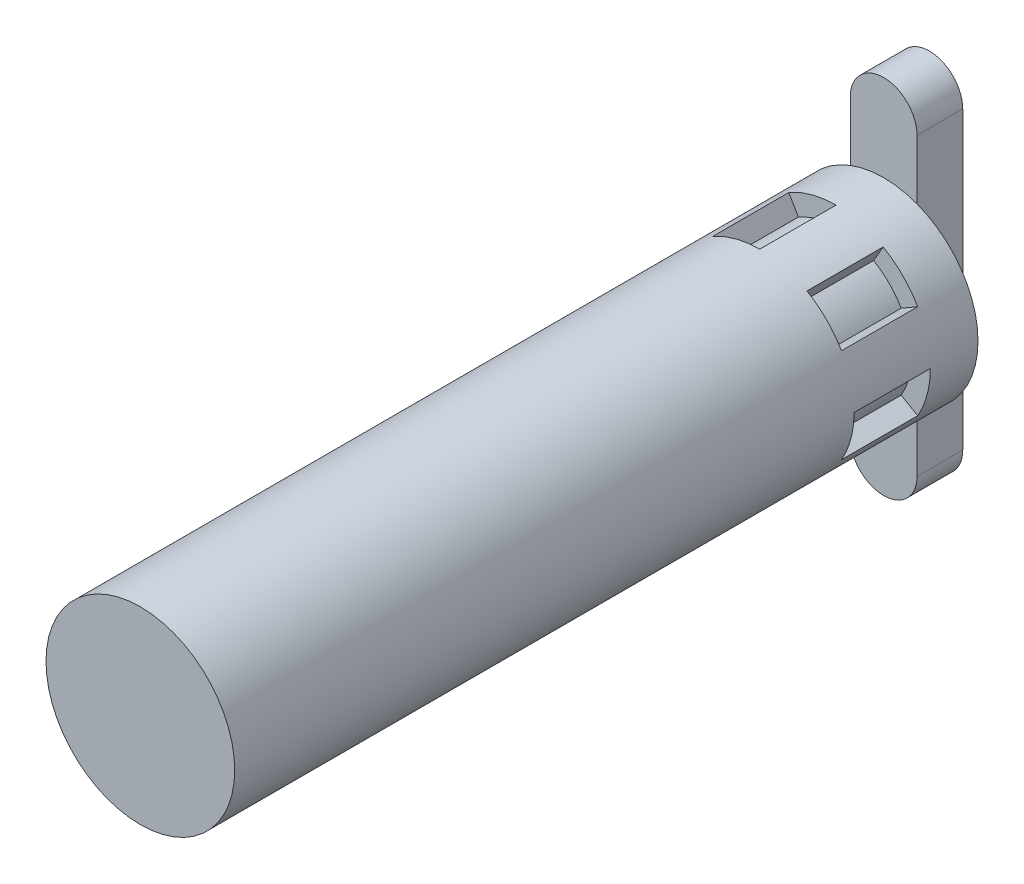
from build123d import *

# Parameters (mm, degrees)
SKETCH_1_R               = 4.95
EXTRUDE_1_DEPTH          = 4.5
CUT_EXTRUDE_1_DEPTH      = 2
PATTERN_CIRCULAR_1_COUNT = 6
MIRROR_1_COPY_1_DEPTH    = 2
MIRROR_1_COPY_2_DEPTH    = 2
MIRROR_1_COPY_3_DEPTH    = 2
MIRROR_1_COPY_4_DEPTH    = 2
MIRROR_1_COPY_5_DEPTH    = 2
EXTRUDE_2_DEPTH          = 2.4
SKETCH_5_R               = 4.95
EXTRUDE_3_DEPTH          = 30


with BuildPart() as part:
    # 草图1 → 凸台-拉伸1 (new body)
    with BuildSketch(Plane.XY):
        Circle(SKETCH_1_R)
    extrude_1 = extrude(amount=EXTRUDE_1_DEPTH)

    # 草图2 → 切除-拉伸1 (cut)
    with BuildSketch(Plane(origin=(0, 0, 0), x_dir=(-1, 0, 0), z_dir=(0, 0, -1))):
        with BuildLine():
            Line((0, 4.95), (0, 3.95))
            ThreePointArc((0, 3.95), (1.022335228, 3.815407014), (1.975, 3.420800345))
            Line((1.975, 3.420800345), (2.475, 4.286825749))
            ThreePointArc((2.475, 4.286825749), (1.281154273, 4.78133284), (0, 4.95))
        make_face()
    cut_extrude_1 = extrude(amount=-CUT_EXTRUDE_1_DEPTH, mode=Mode.SUBTRACT)

    # 阵列(圆周)1: 切除-拉伸1 ×6 about axis
    pattern_circular_1_axis = Axis((0, 0, 4.5), (0, 0, 1))
    for i in range(1, PATTERN_CIRCULAR_1_COUNT):
        add(cut_extrude_1.rotate(pattern_circular_1_axis, i * 360 / PATTERN_CIRCULAR_1_COUNT), mode=Mode.SUBTRACT)

    # 镜向1: 凸台-拉伸1, 切除-拉伸1 across plane
    add(extrude_1.mirror(Plane.XY))
    add(cut_extrude_1.mirror(Plane.XY), mode=Mode.SUBTRACT)

    # 镜向1 copy 1 sketch → 镜向1 copy 1 (cut)
    with BuildSketch(Plane(origin=(0, 0, 0), x_dir=(-0.5000000000000001, -0.8660254037844386, 0), z_dir=(0, 0, 1))):
        with BuildLine():
            Line((0, -4.95), (0, -3.95))
            ThreePointArc((0, -3.95), (1.022335228, -3.815407014), (1.975, -3.420800345))
            Line((1.975, -3.420800345), (2.475, -4.286825749))
            ThreePointArc((2.475, -4.286825749), (1.281154273, -4.78133284), (0, -4.95))
        make_face()
    extrude(amount=-MIRROR_1_COPY_1_DEPTH, mode=Mode.SUBTRACT)

    # 镜向1 copy 2 sketch → 镜向1 copy 2 (cut)
    with BuildSketch(Plane(origin=(0, 0, 0), x_dir=(0.4999999999999998, -0.8660254037844387, 0), z_dir=(0, 0, 1))):
        with BuildLine():
            Line((0, -4.95), (0, -3.95))
            ThreePointArc((0, -3.95), (1.022335228, -3.815407014), (1.975, -3.420800345))
            Line((1.975, -3.420800345), (2.475, -4.286825749))
            ThreePointArc((2.475, -4.286825749), (1.281154273, -4.78133284), (0, -4.95))
        make_face()
    extrude(amount=-MIRROR_1_COPY_2_DEPTH, mode=Mode.SUBTRACT)

    # 镜向1 copy 3 sketch → 镜向1 copy 3 (cut)
    with BuildSketch(Plane.XY):
        with BuildLine():
            Line((0, -4.95), (0, -3.95))
            ThreePointArc((0, -3.95), (1.022335228, -3.815407014), (1.975, -3.420800345))
            Line((1.975, -3.420800345), (2.475, -4.286825749))
            ThreePointArc((2.475, -4.286825749), (1.281154273, -4.78133284), (0, -4.95))
        make_face()
    extrude(amount=-MIRROR_1_COPY_3_DEPTH, mode=Mode.SUBTRACT)

    # 镜向1 copy 4 sketch → 镜向1 copy 4 (cut)
    with BuildSketch(Plane(origin=(0, 0, 0), x_dir=(0.5000000000000004, 0.8660254037844384, 0), z_dir=(0, 0, 1))):
        with BuildLine():
            Line((0, -4.95), (0, -3.95))
            ThreePointArc((0, -3.95), (1.022335228, -3.815407014), (1.975, -3.420800345))
            Line((1.975, -3.420800345), (2.475, -4.286825749))
            ThreePointArc((2.475, -4.286825749), (1.281154273, -4.78133284), (0, -4.95))
        make_face()
    extrude(amount=-MIRROR_1_COPY_4_DEPTH, mode=Mode.SUBTRACT)

    # 镜向1 copy 5 sketch → 镜向1 copy 5 (cut)
    with BuildSketch(Plane(origin=(0, 0, 0), x_dir=(-0.5000000000000001, 0.8660254037844386, 0), z_dir=(0, 0, 1))):
        with BuildLine():
            Line((0, -4.95), (0, -3.95))
            ThreePointArc((0, -3.95), (1.022335228, -3.815407014), (1.975, -3.420800345))
            Line((1.975, -3.420800345), (2.475, -4.286825749))
            ThreePointArc((2.475, -4.286825749), (1.281154273, -4.78133284), (0, -4.95))
        make_face()
    extrude(amount=-MIRROR_1_COPY_5_DEPTH, mode=Mode.SUBTRACT)

    # 草图3 → 凸台-拉伸2 (add)
    with BuildSketch(Plane(origin=(0, 0, -4.5), x_dir=(-1, 0, 0), z_dir=(0, 0, -1))):
        with BuildLine():
            Line((1.75, 7.75), (1.75, -7.75))
            ThreePointArc((1.75, -7.75), (0, -9.5), (-1.75, -7.75))
            Line((-1.75, -7.75), (-1.75, 7.75))
            ThreePointArc((-1.75, 7.75), (0, 9.5), (1.75, 7.75))
        make_face()
    extrude(amount=EXTRUDE_2_DEPTH)

    # 草图5 → 凸台-拉伸3 (add)
    with BuildSketch(Plane.XY.offset(4.5)):
        Circle(SKETCH_5_R)
    extrude(amount=EXTRUDE_3_DEPTH)


solid = part.part
